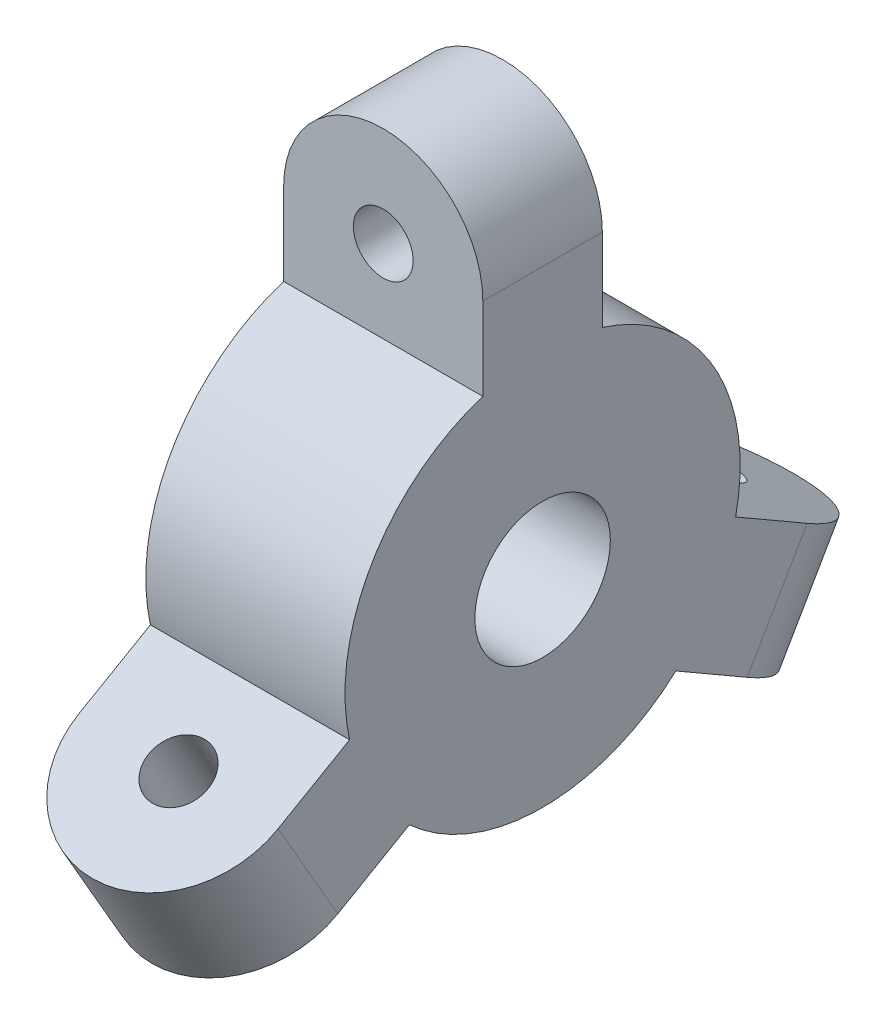
from build123d import *

# Parameters (mm, degrees)
BOSS_EXTRU_1_DEPTH           = 5
BOSS_EXTRU_1_DEPTH_BACK      = 5
TROU_TARAUD_M81_D            = 6.8
ESQUISSE5_R                  = 1.5
ENL_V_MAT_EXTRU_1_DEPTH      = 29.207315586
R_P_TITION_CIRCULAIRE1_COUNT = 3


with BuildPart() as part:
    # Esquisse1 → Boss.-Extru.1 (new, two sides: drawn at the far end of the back side and taken through both)
    with BuildSketch(Plane(origin=(0, 0, 0), x_dir=(0, 0, -1), z_dir=(1, 0, 0)).offset(-BOSS_EXTRU_1_DEPTH_BACK)):
        with BuildLine():
            Line((-3, 18.6), (3, 18.6))
            Line((3, 18.6), (3, 9.455495756))
            ThreePointArc((3, 9.455495756), (8.590972006, 4.96), (9.68869953, -2.129671667))
            Line((9.68869953, -2.129671667), (17.60807251, -6.701923789))
            Line((17.60807251, -6.701923789), (14.60807251, -11.898076211))
            Line((14.60807251, -11.898076211), (6.68869953, -7.32582409))
            ThreePointArc((6.68869953, -7.32582409), (0, -9.92), (-6.68869953, -7.32582409))
            Line((-6.68869953, -7.32582409), (-14.60807251, -11.898076211))
            Line((-14.60807251, -11.898076211), (-17.60807251, -6.701923789))
            Line((-17.60807251, -6.701923789), (-9.68869953, -2.129671667))
            ThreePointArc((-9.68869953, -2.129671667), (-8.590972006, 4.96), (-3, 9.455495756))
            Line((-3, 9.455495756), (-3, 18.6))
        make_face()
    extrude(amount=BOSS_EXTRU_1_DEPTH + BOSS_EXTRU_1_DEPTH_BACK)

    # Trou taraudé M81 (through all)
    with Locations(Plane(origin=(5, 0, 0), x_dir=(0, 0, -1), z_dir=(1, 0, 0))):
        with Locations((0, 0)):
            Hole(TROU_TARAUD_M81_D / 2)

    # Esquisse5 → Enlèv. mat.-Extru.1 (cut, through all)
    with BuildSketch(Plane.XY.offset(3)):
        with Locations((0, 13.6)):
            Circle(ESQUISSE5_R)
        with BuildLine():
            Line((-5, 9.455495756), (-5, 13.6))
            ThreePointArc((-5, 13.6), (0, 18.6), (5, 13.6))
            Line((5, 13.6), (5, 9.455495756))
            Line((5, 9.455495756), (13.62028311, 9.455495756))
            Line((13.62028311, 9.455495756), (13.62028311, 23.6))
            Line((13.62028311, 23.6), (-13.199246966, 23.6))
            Line((-13.199246966, 23.6), (-13.199246966, 9.455495756))
            Line((-13.199246966, 9.455495756), (-5, 9.455495756))
        make_face()
    enl_v_mat_extru_1 = extrude(amount=-ENL_V_MAT_EXTRU_1_DEPTH, mode=Mode.SUBTRACT)

    # Répétition circulaire1: Enlèv. mat.-Extru.1 ×3 about axis
    r_p_tition_circulaire1_axis = Axis((5, 0, 0), (1, 0, 0))
    for i in range(1, R_P_TITION_CIRCULAIRE1_COUNT):
        add(enl_v_mat_extru_1.rotate(r_p_tition_circulaire1_axis, i * 360 / R_P_TITION_CIRCULAIRE1_COUNT), mode=Mode.SUBTRACT)


solid = part.part
